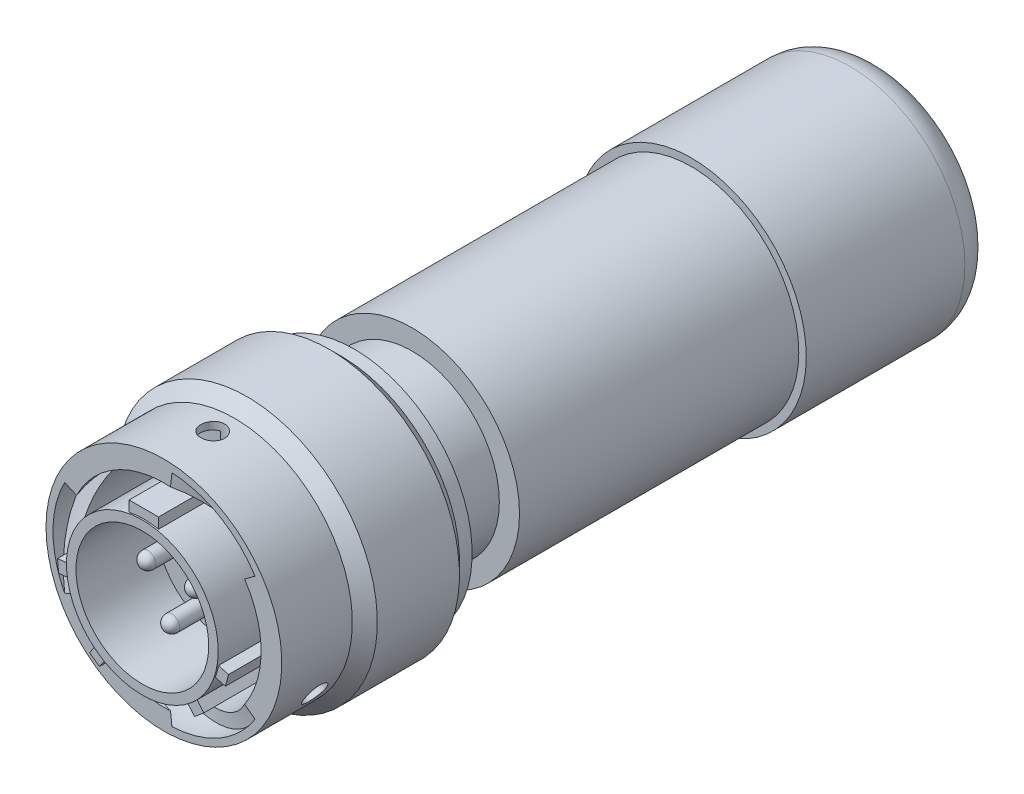
from build123d import *

# Parameters (mm, degrees)
SKETCH3_W               = 22.7718
SKETCH3_H               = 6.5532
BOSS_EXTRUDE1_START     = -9.2202
BOSS_EXTRUDE1_DEPTH     = 9.0678
SKETCH6_R               = 1.1938
CUT_EXTRUDE1_DEPTH      = 38.374523408
CUT_SWEEP1_PITCH        = 19.5072
CIRPATTERN1_COUNT       = 3
SKETCH12_3P_R           = 0.79375
BOSS_EXTRUDE12_3P_DEPTH = 5.7912
FILLET12_3P_R           = 0.79375


with BuildPart() as part:
    # Sketch3 → Revolve1 (revolve)
    with BuildSketch(Plane(origin=(0, 0, 0), x_dir=(0, 0, -1), z_dir=(1, 0, 0)), mode=Mode.PRIVATE) as revolve1_sk:
        Polygon((9.7282, 8.636), (9.7282, 7.672916667), (19.8, 7.672916667), (20.858333333, 8.73125), (31.441666667, 8.73125), (32.5, 7.672916667), (32.5, 6.6421), (0, 6.6421), (0, 7.5946), (9.2202, 7.5946), (9.2202, 8.636), align=None)
        with Locations((19.3361, 3.2766)):
            Rectangle(SKETCH3_W, SKETCH3_H)
    revolve(revolve1_sk.sketch.rotate(Axis((0, 0, 0), (0, 0, -1)), 90), axis=Axis((0, 0, 0), (0, 0, -1)))

    # Sketch4 → Boss-Extrude1 (add)
    with BuildSketch(Plane.XY.offset(BOSS_EXTRUDE1_START)):
        with BuildLine():
            Line((-1.4732, 8.509417005), (1.4732, 8.509417005))
            Line((1.4732, 8.509417005), (1.4732, 7.450344349))
            ThreePointArc((1.4732, 7.450344349), (0, 7.5946), (-1.4732, 7.450344349))
            Line((-1.4732, 7.450344349), (-1.4732, 8.509417005))
        make_face()
        with BuildLine():
            Line((8.478703395, -1.640757368), (8.163151215, -2.818414135))
            Line((8.163151215, -2.818414135), (7.154374095, -2.548113121))
            ThreePointArc((7.154374095, -2.548113121), (7.33582028, -1.96562712), (7.469926274, -1.370456353))
            Line((7.469926274, -1.370456353), (8.478703395, -1.640757368))
        make_face()
        with BuildLine():
            Line((6.004247455, -6.20721423), (5.07028607, -6.990900884))
            Line((5.07028607, -6.990900884), (4.398982522, -6.190872469))
            ThreePointArc((4.398982522, -6.190872469), (4.881714781, -5.817801128), (5.332943907, -5.407185816))
            Line((5.332943907, -5.407185816), (6.004247455, -6.20721423))
        make_face()
        with BuildLine():
            Line((-4.441694942, -7.406202944), (-5.440405114, -6.706898553))
            Line((-5.440405114, -6.706898553), (-4.84138315, -5.851406528))
            ThreePointArc((-4.84138315, -5.851406528), (-4.356083604, -6.221132116), (-3.842672977, -6.550710919))
            Line((-3.842672977, -6.550710919), (-4.441694942, -7.406202944))
        make_face()
        with BuildLine():
            Line((-8.528547084, -1.358079759), (-8.634807366, -0.143519183))
            Line((-8.634807366, -0.143519183), (-7.594418558, -0.052496957))
            ThreePointArc((-7.594418558, -0.052496957), (-7.565700254, -0.661913004), (-7.488158276, -1.267057533))
            Line((-7.488158276, -1.267057533), (-8.528547084, -1.358079759))
        make_face()
    extrude(amount=BOSS_EXTRUDE1_DEPTH)

    # Sketch12-3P → Boss-Extrude12-3P (add)
    with BuildSketch(Plane.XY.offset(-7.9502)):
        with Locations(Location((2.3876, 1.4732, 0), (0, 0, 180))):
            Circle(SKETCH12_3P_R)
        with Locations(Location((0, -2.8194, 0), (0, 0, 180))):
            Circle(SKETCH12_3P_R)
        with Locations(Location((-2.3876, 1.4732, 0), (0, 0, 180))):
            Circle(SKETCH12_3P_R)
    extrude(amount=BOSS_EXTRUDE12_3P_DEPTH)

    # Fillet12-3P
    fillet12_3p_edges = [part.edges().sort_by_distance(p)[0] for p in [
        (0.79375, -2.8194, -2.159),
        (-1.59385, 1.4732, -2.159),
        (3.18135, 1.4732, -2.159),
    ]]
    fillet(fillet12_3p_edges, radius=FILLET12_3P_R)


with BuildPart() as body_2:
    # Sketch5 → Revolve2 (revolve)
    with BuildSketch(Plane(origin=(0, 0, 0), x_dir=(0, 0, -1), z_dir=(1, 0, 0)), mode=Mode.PRIVATE) as revolve2_sk:
        Polygon((2.159, 11.8), (2.159, 9.7282), (17.399, 9.7282), (17.399, 10.9982), (21.209, 10.9982), (21.209, 11.8), (19.939, 11.8), (18.689, 13.05), (10.4702, 13.05), (9.2202, 11.8), align=None)
    revolve(revolve2_sk.sketch.rotate(Axis((0, 0, -32.5), (0, 0, 1)), 90), axis=Axis((0, 0, -32.5), (0, 0, 1)))

    # Sketch6 → Cut-Extrude1 (cut, through all)
    with BuildSketch(Plane(origin=(0, 0, 0), x_dir=(1, 0, 0), z_dir=(0, 1, 0))):
        with Locations(Location((0, 7.0358, 0), (0, 0, 90))):
            Circle(SKETCH6_R)
    cut_extrude1 = extrude(amount=CUT_EXTRUDE1_DEPTH, mode=Mode.SUBTRACT)

    # Cut-Sweep1: arcs per turn and ends read off the stored shape
    # Cut-Sweep1: the profile of Sketch8 screwed along a right-hand helix through 1.25 turns, 20 arcs to a turn; built about Z, then put on its axis
    cut_sweep1_z = Axis((0, 0, 0), (0, 0, 1))
    cut_sweep1_corners = [(9.634605379, 0.409289625, -20.789672785), (11.021935612, 0.409289625, -20.789672785), (11.021935612, -0.409289625, -18.224727215), (9.634605379, -0.409289625, -18.224727215)]
    with BuildLine(mode=Mode.PRIVATE) as cut_sweep1_profile:
        Line(cut_sweep1_corners[0], cut_sweep1_corners[1])
        Line(cut_sweep1_corners[2], cut_sweep1_corners[3])
        ThreePointArc((11.021935612, 0.409289625, -20.789672785), (11.103842536, 0, -19.5072), (11.021935612, -0.409289625, -18.224727215))
        ThreePointArc((9.634605379, -0.409289625, -18.224727215), (9.7282, 0, -19.5072), (9.634605379, 0.409289625, -20.789672785))
    cut_sweep1_cap = Face(cut_sweep1_profile.wire())
    cut_sweep1_arcs = [((11.021935612, 0.409289625, -20.789672785), (11.186358133, 0, -19.5072), (11.021935612, -0.409289625, -18.224727215), (1, 0.9926235513315216, 1)), ((9.634605379, -0.409289625, -18.224727215), (9.822703839, 0, -19.5072), (9.634605379, 0.409289625, -20.789672785), (1, 0.9903790401646793, 1))]  # start, shoulder, end, weights
    cut_sweep1_turn_angles = [0, 9, 18, 27, 36, 45, 54, 63, 72, 81, 90, 99, 108, 117, 126, 135, 144, 153, 162, 171, 180, 189, 198, 207, 216, 225, 234, 243, 252, 261, 270, 279, 288, 297, 306, 315, 324, 333, 342, 351, 360]
    cut_sweep1_turn_weights = [1, 0.9876883405951378, 1, 0.9876883405951378, 1, 0.9876883405951378, 1, 0.9876883405951378, 1, 0.9876883405951378, 1, 0.9876883405951378, 1, 0.9876883405951378, 1, 0.9876883405951378, 1, 0.9876883405951378, 1, 0.9876883405951378, 1, 0.9876883405951378, 1, 0.9876883405951378, 1, 0.9876883405951378, 1, 0.9876883405951378, 1, 0.9876883405951378, 1, 0.9876883405951378, 1, 0.9876883405951378, 1, 0.9876883405951378, 1, 0.9876883405951378, 1, 0.9876883405951378, 1]
    cut_sweep1_turn_rails = [Edge.make_bspline([Vector(p[0], p[1], 0).rotate(cut_sweep1_z, cut_sweep1_turn_angles[k]) / cut_sweep1_turn_weights[k] + Vector(0, 0, p[2] + CUT_SWEEP1_PITCH * cut_sweep1_turn_angles[k] / 360) for k in range(41)], [0, 0, 0, 1, 1, 2, 2, 3, 3, 4, 4, 5, 5, 6, 6, 7, 7, 8, 8, 9, 9, 10, 10, 11, 11, 12, 12, 13, 13, 14, 14, 15, 15, 16, 16, 17, 17, 18, 18, 19, 19, 20, 20, 20], 2, cut_sweep1_turn_weights) for p in cut_sweep1_corners]
    cut_sweep1_turn_sides = [*[Face.make_surface_from_curves(cut_sweep1_turn_rails[p[0]], cut_sweep1_turn_rails[p[1]]) for p in [(0, 1), (2, 3)]], *[Face.make_bezier_surface([[Vector(p[j][0], p[j][1], 0).rotate(cut_sweep1_z, cut_sweep1_turn_angles[2 * i + k]) / cut_sweep1_turn_weights[2 * i + k] + Vector(0, 0, p[j][2] + CUT_SWEEP1_PITCH * cut_sweep1_turn_angles[2 * i + k] / 360) for k in range(3)] for j in range(3)], [[p[3][j] * cut_sweep1_turn_weights[2 * i + k] for k in range(3)] for j in range(3)]) for p in cut_sweep1_arcs for i in range(20)]]
    cut_sweep1_last_angles = [360, 369, 378, 387, 396, 405, 414, 423, 432, 441, 450]
    cut_sweep1_last_weights = [1, 0.9876883405951378, 1, 0.9876883405951378, 1, 0.9876883405951378, 1, 0.9876883405951378, 1, 0.9876883405951378, 1]
    cut_sweep1_last_rails = [Edge.make_bspline([Vector(p[0], p[1], 0).rotate(cut_sweep1_z, cut_sweep1_last_angles[k]) / cut_sweep1_last_weights[k] + Vector(0, 0, p[2] + CUT_SWEEP1_PITCH * cut_sweep1_last_angles[k] / 360) for k in range(11)], [0, 0, 0, 1, 1, 2, 2, 3, 3, 4, 4, 5, 5, 5], 2, cut_sweep1_last_weights) for p in cut_sweep1_corners]
    cut_sweep1_last_sides = [*[Face.make_surface_from_curves(cut_sweep1_last_rails[p[0]], cut_sweep1_last_rails[p[1]]) for p in [(0, 1), (2, 3)]], *[Face.make_bezier_surface([[Vector(p[j][0], p[j][1], 0).rotate(cut_sweep1_z, cut_sweep1_last_angles[2 * i + k]) / cut_sweep1_last_weights[2 * i + k] + Vector(0, 0, p[j][2] + CUT_SWEEP1_PITCH * cut_sweep1_last_angles[2 * i + k] / 360) for k in range(3)] for j in range(3)], [[p[3][j] * cut_sweep1_last_weights[2 * i + k] for k in range(3)] for j in range(3)]) for p in cut_sweep1_arcs for i in range(5)]]
    cut_sweep1 = Plane(origin=(0, 0, -2.159), x_dir=(-1, 0, 0), z_dir=(0, 0, -1)) * Solid(Shell([*cut_sweep1_turn_sides, *cut_sweep1_last_sides, cut_sweep1_cap, cut_sweep1_cap.rotate(cut_sweep1_z, 450).moved(Location((0, 0, CUT_SWEEP1_PITCH * 450 / 360)))]))
    add(cut_sweep1, mode=Mode.SUBTRACT)

    # CirPattern1: Cut-Extrude1, Cut-Sweep1 ×3 about axis
    cirpattern1_axis = Axis((0, 0, -32.5), (0, 0, -1))
    add([cut_extrude1.rotate(cirpattern1_axis, i * 360 / CIRPATTERN1_COUNT) for i in range(1, CIRPATTERN1_COUNT)], mode=Mode.SUBTRACT)
    add([cut_sweep1.rotate(cirpattern1_axis, i * 360 / CIRPATTERN1_COUNT) for i in range(1, CIRPATTERN1_COUNT)], mode=Mode.SUBTRACT)


with BuildPart() as body_3:
    # Sketch9 → Revolve3 (revolve)
    with BuildSketch(Plane(origin=(0, 0, 0), x_dir=(0, 0, -1), z_dir=(1, 0, 0)), mode=Mode.PRIVATE) as revolve3_sk:
        with BuildLine():
            Line((27, 10.75), (27, 8.73125))
            Line((27, 8.73125), (70.825, 8.73125))
            ThreePointArc((70.825, 8.73125), (71.11226213, 8.61226213), (71.23125, 8.325))
            Line((71.23125, 8.325), (71.23125, 5.15))
            Line((71.23125, 5.15), (74, 5.15))
            Line((74, 5.15), (74, 8.325))
            ThreePointArc((74, 8.325), (73.07006403, 10.57006403), (70.825, 11.5))
            Line((70.825, 11.5), (54.95, 11.5))
            Line((54.95, 11.5), (54.95, 10.75))
            Line((54.95, 10.75), (27, 10.75))
        make_face()
    revolve(revolve3_sk.sketch.rotate(Axis((0, 0, 0), (0, 0, -1)), 90), axis=Axis((0, 0, 0), (0, 0, -1)))


solid = Compound([part.part, body_2.part, body_3.part])
